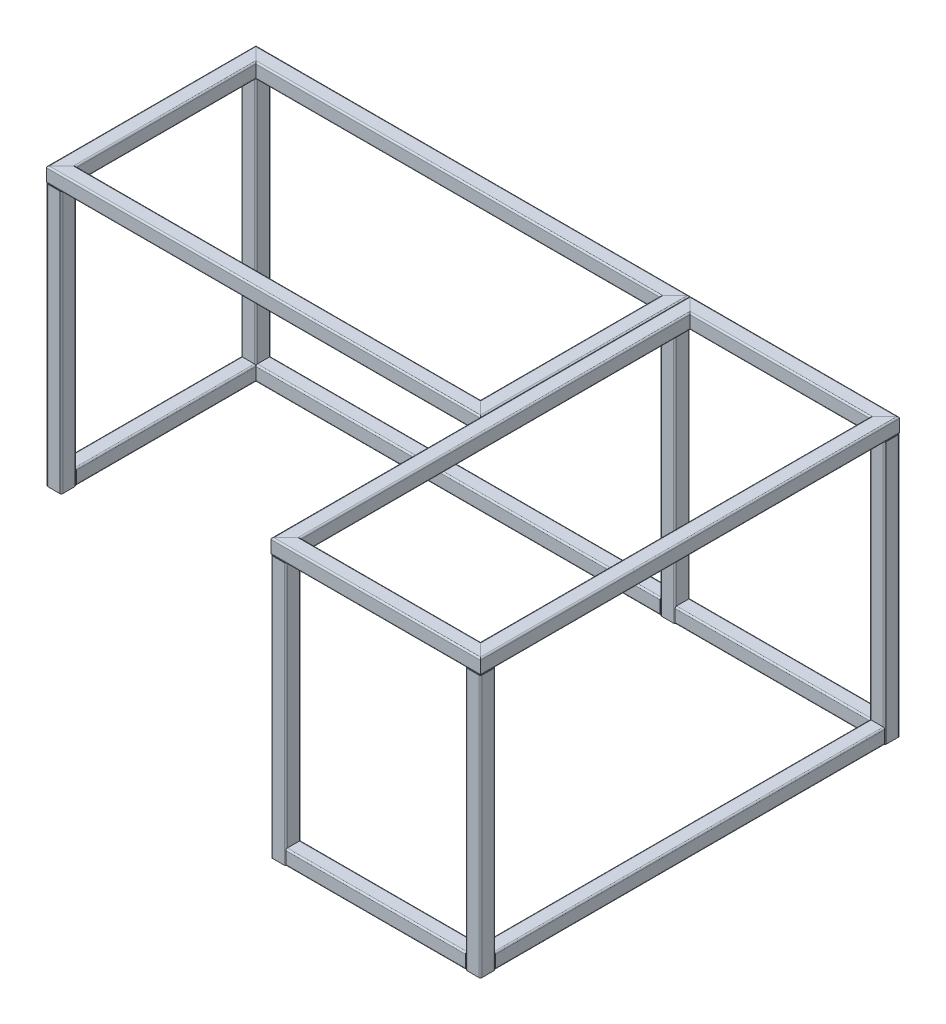
from build123d import *

# Parameters (mm, degrees)
SHS_C350_AS_40X40X2_0_SHS_C350_1_DEPTH      = 617.568542495
SHS_C350_AS_40X40X2_0_SHS_C350_1_DEPTH_BACK = 57.568542495
SHS_C350_AS_40X40X2_0_SHS_C350_1_2_DEPTH    = 1275.13708499
SHS_C350_AS_40X40X2_0_SHS_C350_1_3_DEPTH    = 675.13708499
SHS_C350_AS_40X40X2_0_SHS_C350_1_4_DEPTH    = 1275.13708499
SHS_C350_AS_40X40X2_0_SHS_C350_2_DEPTH      = 1177.568542495
SHS_C350_AS_40X40X2_0_SHS_C350_2_DEPTH_BACK = 57.568542495
SHS_C350_AS_40X40X2_0_SHS_C350_2_2_DEPTH    = 675.13708499
SHS_C350_AS_40X40X2_0_SHS_C350_2_3_DEPTH    = 1235.13708499
SHS_C350_AS_40X40X2_0_SHS_C350_2_4_DEPTH    = 675.13708499
SHS_START                                   = -740
SHS_C350_AS_40X40X2_0_SHS_C350_8_DEPTH      = 700
SHS_START_2                                 = -240
SHS_C350_AS_40X40X2_0_SHS_C350_8_2_DEPTH    = 480
SHS_START_3                                 = -540
SHS_C350_AS_40X40X2_0_SHS_C350_8_3_DEPTH    = 1080
SHS_START_4                                 = 580
SHS_C350_AS_40X40X2_0_SHS_C350_8_4_DEPTH    = 520
SHS_C350_AS_40X40X2_0_SHS_C350_8_5_DEPTH    = 1040
SHS_START_5                                 = 620
SHS_C350_AS_40X40X2_0_SHS_C350_8_6_DEPTH    = 480
SHS_C350_AS_40X40X2_0_SHS_C350_8_7_DEPTH    = 700
SHS_C350_AS_40X40X2_0_SHS_C350_8_8_DEPTH    = 700
SHS_C350_AS_40X40X2_0_SHS_C350_8_9_DEPTH    = 700
SHS_C350_AS_40X40X2_0_SHS_C350_8_10_DEPTH   = 700
SHS_C350_AS_40X40X2_0_SHS_C350_8_11_DEPTH   = 700


with BuildPart() as part:
    # Sketch11 → Shs c350 as 40X40X2.0 SHS C350(1) (new, two sides: drawn at the far end of the back side and taken through both)
    with BuildSketch(Plane(origin=(-560, -20, 280), x_dir=(-1, 0, 0), z_dir=(0, 0, -1)).offset(-SHS_C350_AS_40X40X2_0_SHS_C350_1_DEPTH_BACK)):
        with BuildLine():
            Line((-16, -20), (16, -20))
            ThreePointArc((16, -20), (18.828427125, -18.828427125), (20, -16))
            Line((20, -16), (20, 16))
            ThreePointArc((20, 16), (18.828427125, 18.828427125), (16, 20))
            Line((16, 20), (-16, 20))
            ThreePointArc((-16, 20), (-18.828427125, 18.828427125), (-20, 16))
            Line((-20, 16), (-20, -16))
            ThreePointArc((-20, -16), (-18.828427125, -18.828427125), (-16, -20))
        make_face()
        with BuildLine():
            Line((-16, 18), (16, 18))
            ThreePointArc((16, 18), (17.414213562, 17.414213562), (18, 16))
            Line((18, 16), (18, -16))
            ThreePointArc((18, -16), (17.414213562, -17.414213562), (16, -18))
            Line((16, -18), (-16, -18))
            ThreePointArc((-16, -18), (-17.414213562, -17.414213562), (-18, -16))
            Line((-18, -16), (-18, 16))
            ThreePointArc((-18, 16), (-17.414213562, 17.414213562), (-16, 18))
        make_face(mode=Mode.SUBTRACT)
    extrude(amount=SHS_C350_AS_40X40X2_0_SHS_C350_1_DEPTH + SHS_C350_AS_40X40X2_0_SHS_C350_1_DEPTH_BACK)

    # Shs c350 as 40X40X2.0 SHS C350(1) mitre 1
    split(bisect_by=Plane(origin=(-580, 0, 280), x_dir=(0, -1, 0), z_dir=(-0.707106781, 0, -0.707106781)), keep=Keep.TOP)

    # Shs c350 as 40X40X2.0 SHS C350(1) mitre 2
    split(bisect_by=Plane(origin=(-580, 0, -280), x_dir=(0, -1, 0), z_dir=(-0.707106781, 0, 0.707106781)), keep=Keep.TOP)


with BuildPart() as body_2:
    # Sketch11 on segment 2 (carried to segment 2) → Shs c350 as 40X40X2.0 SHS C350_1 2 (new body)
    with BuildSketch(Plane(origin=(-637.568542495, -20, -260), x_dir=(0, 0, -1), z_dir=(1, 0, 0))):
        with BuildLine():
            Line((-16, -20), (16, -20))
            ThreePointArc((16, -20), (18.828427125, -18.828427125), (20, -16))
            Line((20, -16), (20, 16))
            ThreePointArc((20, 16), (18.828427125, 18.828427125), (16, 20))
            Line((16, 20), (-16, 20))
            ThreePointArc((-16, 20), (-18.828427125, 18.828427125), (-20, 16))
            Line((-20, 16), (-20, -16))
            ThreePointArc((-20, -16), (-18.828427125, -18.828427125), (-16, -20))
        make_face()
        with BuildLine():
            Line((-16, 18), (16, 18))
            ThreePointArc((16, 18), (17.414213562, 17.414213562), (18, 16))
            Line((18, 16), (18, -16))
            ThreePointArc((18, -16), (17.414213562, -17.414213562), (16, -18))
            Line((16, -18), (-16, -18))
            ThreePointArc((-16, -18), (-17.414213562, -17.414213562), (-18, -16))
            Line((-18, -16), (-18, 16))
            ThreePointArc((-18, 16), (-17.414213562, 17.414213562), (-16, 18))
        make_face(mode=Mode.SUBTRACT)
    extrude(amount=SHS_C350_AS_40X40X2_0_SHS_C350_1_2_DEPTH)

    # Shs c350 as 40X40X2.0 SHS C350_1 2 mitre
    split(bisect_by=Plane(origin=(-580, 0, -280), x_dir=(0, 1, 0), z_dir=(0.707106781, 0, -0.707106781)), keep=Keep.TOP)

    # Shs c350 as 40X40X2.0 SHS C350_1 2 m 2
    split(bisect_by=Plane(origin=(580, 0, -280), x_dir=(0, -1, 0), z_dir=(-0.707106781, 0, -0.707106781)), keep=Keep.TOP)


with BuildPart() as body_3:
    # Sketch11 on segment 3 (carried to segment 3) → Shs c350 as 40X40X2.0 SHS C350_1 3 (new body)
    with BuildSketch(Plane(origin=(560, -20, -337.568542495), x_dir=(1, 0, 0), z_dir=(0, 0, 1))):
        with BuildLine():
            Line((-16, -20), (16, -20))
            ThreePointArc((16, -20), (18.828427125, -18.828427125), (20, -16))
            Line((20, -16), (20, 16))
            ThreePointArc((20, 16), (18.828427125, 18.828427125), (16, 20))
            Line((16, 20), (-16, 20))
            ThreePointArc((-16, 20), (-18.828427125, 18.828427125), (-20, 16))
            Line((-20, 16), (-20, -16))
            ThreePointArc((-20, -16), (-18.828427125, -18.828427125), (-16, -20))
        make_face()
        with BuildLine():
            Line((-16, 18), (16, 18))
            ThreePointArc((16, 18), (17.414213562, 17.414213562), (18, 16))
            Line((18, 16), (18, -16))
            ThreePointArc((18, -16), (17.414213562, -17.414213562), (16, -18))
            Line((16, -18), (-16, -18))
            ThreePointArc((-16, -18), (-17.414213562, -17.414213562), (-18, -16))
            Line((-18, -16), (-18, 16))
            ThreePointArc((-18, 16), (-17.414213562, 17.414213562), (-16, 18))
        make_face(mode=Mode.SUBTRACT)
    extrude(amount=SHS_C350_AS_40X40X2_0_SHS_C350_1_3_DEPTH)

    # Shs c350 as 40X40X2.0 SHS C350_1 3 mitre
    split(bisect_by=Plane(origin=(580, 0, 280), x_dir=(0, 1, 0), z_dir=(0.707106781, 0, -0.707106781)), keep=Keep.TOP)

    # Shs c350 as 40X40X2.0 SHS C350_1 3 m 2
    split(bisect_by=Plane(origin=(580, 0, -280), x_dir=(0, 1, 0), z_dir=(0.707106781, 0, 0.707106781)), keep=Keep.TOP)


with BuildPart() as body_4:
    # Sketch11 on segment 4 (carried to segment 4) → Shs c350 as 40X40X2.0 SHS C350_1 4 (new body)
    with BuildSketch(Plane(origin=(637.568542495, -20, 260), x_dir=(0, 0, 1), z_dir=(-1, 0, 0))):
        with BuildLine():
            Line((-16, -20), (16, -20))
            ThreePointArc((16, -20), (18.828427125, -18.828427125), (20, -16))
            Line((20, -16), (20, 16))
            ThreePointArc((20, 16), (18.828427125, 18.828427125), (16, 20))
            Line((16, 20), (-16, 20))
            ThreePointArc((-16, 20), (-18.828427125, 18.828427125), (-20, 16))
            Line((-20, 16), (-20, -16))
            ThreePointArc((-20, -16), (-18.828427125, -18.828427125), (-16, -20))
        make_face()
        with BuildLine():
            Line((-16, 18), (16, 18))
            ThreePointArc((16, 18), (17.414213562, 17.414213562), (18, 16))
            Line((18, 16), (18, -16))
            ThreePointArc((18, -16), (17.414213562, -17.414213562), (16, -18))
            Line((16, -18), (-16, -18))
            ThreePointArc((-16, -18), (-17.414213562, -17.414213562), (-18, -16))
            Line((-18, -16), (-18, 16))
            ThreePointArc((-18, 16), (-17.414213562, 17.414213562), (-16, 18))
        make_face(mode=Mode.SUBTRACT)
    extrude(amount=SHS_C350_AS_40X40X2_0_SHS_C350_1_4_DEPTH)

    # Shs c350 as 40X40X2.0 SHS C350_1 4 mitre
    split(bisect_by=Plane(origin=(-580, 0, 280), x_dir=(0, 1, 0), z_dir=(0.707106781, 0, 0.707106781)), keep=Keep.TOP)

    # Shs c350 as 40X40X2.0 SHS C350_1 4 m 2
    split(bisect_by=Plane(origin=(580, 0, 280), x_dir=(0, -1, 0), z_dir=(-0.707106781, 0, 0.707106781)), keep=Keep.TOP)


with BuildPart() as body_5:
    # Sketch12 → Shs c350 as 40X40X2.0 SHS C350(2) (new, two sides: drawn at the far end of the back side and taken through both)
    with BuildSketch(Plane(origin=(600, -20, -280), x_dir=(1, 0, 0), z_dir=(0, 0, 1)).offset(-SHS_C350_AS_40X40X2_0_SHS_C350_2_DEPTH_BACK)):
        with BuildLine():
            Line((-16, -20), (16, -20))
            ThreePointArc((16, -20), (18.828427125, -18.828427125), (20, -16))
            Line((20, -16), (20, 16))
            ThreePointArc((20, 16), (18.828427125, 18.828427125), (16, 20))
            Line((16, 20), (-16, 20))
            ThreePointArc((-16, 20), (-18.828427125, 18.828427125), (-20, 16))
            Line((-20, 16), (-20, -16))
            ThreePointArc((-20, -16), (-18.828427125, -18.828427125), (-16, -20))
        make_face()
        with BuildLine():
            Line((-16, 18), (16, 18))
            ThreePointArc((16, 18), (17.414213562, 17.414213562), (18, 16))
            Line((18, 16), (18, -16))
            ThreePointArc((18, -16), (17.414213562, -17.414213562), (16, -18))
            Line((16, -18), (-16, -18))
            ThreePointArc((-16, -18), (-17.414213562, -17.414213562), (-18, -16))
            Line((-18, -16), (-18, 16))
            ThreePointArc((-18, 16), (-17.414213562, 17.414213562), (-16, 18))
        make_face(mode=Mode.SUBTRACT)
    extrude(amount=SHS_C350_AS_40X40X2_0_SHS_C350_2_DEPTH + SHS_C350_AS_40X40X2_0_SHS_C350_2_DEPTH_BACK)

    # Shs c350 as 40X40X2.0 SHS C350(2) mitre 1
    split(bisect_by=Plane(origin=(580, 0, -280), x_dir=(0, -1, 0), z_dir=(-0.707106781, 0, 0.707106781)), keep=Keep.TOP)

    # Shs c350 as 40X40X2.0 SHS C350(2) mitre 2
    split(bisect_by=Plane(origin=(580, 0, 840), x_dir=(0, -1, 0), z_dir=(-0.707106781, 0, -0.707106781)), keep=Keep.TOP)


with BuildPart() as body_6:
    # Sketch12 on segment 2 (carried to segment 2) → Shs c350 as 40X40X2.0 SHS C350_2 2 (new body)
    with BuildSketch(Plane(origin=(522.431457505, -20, 820), x_dir=(0, 0, -1), z_dir=(1, 0, 0))):
        with BuildLine():
            Line((-16, -20), (16, -20))
            ThreePointArc((16, -20), (18.828427125, -18.828427125), (20, -16))
            Line((20, -16), (20, 16))
            ThreePointArc((20, 16), (18.828427125, 18.828427125), (16, 20))
            Line((16, 20), (-16, 20))
            ThreePointArc((-16, 20), (-18.828427125, 18.828427125), (-20, 16))
            Line((-20, 16), (-20, -16))
            ThreePointArc((-20, -16), (-18.828427125, -18.828427125), (-16, -20))
        make_face()
        with BuildLine():
            Line((-16, 18), (16, 18))
            ThreePointArc((16, 18), (17.414213562, 17.414213562), (18, 16))
            Line((18, 16), (18, -16))
            ThreePointArc((18, -16), (17.414213562, -17.414213562), (16, -18))
            Line((16, -18), (-16, -18))
            ThreePointArc((-16, -18), (-17.414213562, -17.414213562), (-18, -16))
            Line((-18, -16), (-18, 16))
            ThreePointArc((-18, 16), (-17.414213562, 17.414213562), (-16, 18))
        make_face(mode=Mode.SUBTRACT)
    extrude(amount=SHS_C350_AS_40X40X2_0_SHS_C350_2_2_DEPTH)

    # Shs c350 as 40X40X2.0 SHS C350_2 2 mitre
    split(bisect_by=Plane(origin=(580, 0, 840), x_dir=(0, 1, 0), z_dir=(0.707106781, 0, 0.707106781)), keep=Keep.TOP)

    # Shs c350 as 40X40X2.0 SHS C350_2 2 m 2
    split(bisect_by=Plane(origin=(1140, 0, 840), x_dir=(0, -1, 0), z_dir=(-0.707106781, 0, 0.707106781)), keep=Keep.TOP)


with BuildPart() as body_7:
    # Sketch12 on segment 3 (carried to segment 3) → Shs c350 as 40X40X2.0 SHS C350_2 3 (new body)
    with BuildSketch(Plane(origin=(1120, -20, 897.568542495), x_dir=(-1, 0, 0), z_dir=(0, 0, -1))):
        with BuildLine():
            Line((-16, -20), (16, -20))
            ThreePointArc((16, -20), (18.828427125, -18.828427125), (20, -16))
            Line((20, -16), (20, 16))
            ThreePointArc((20, 16), (18.828427125, 18.828427125), (16, 20))
            Line((16, 20), (-16, 20))
            ThreePointArc((-16, 20), (-18.828427125, 18.828427125), (-20, 16))
            Line((-20, 16), (-20, -16))
            ThreePointArc((-20, -16), (-18.828427125, -18.828427125), (-16, -20))
        make_face()
        with BuildLine():
            Line((-16, 18), (16, 18))
            ThreePointArc((16, 18), (17.414213562, 17.414213562), (18, 16))
            Line((18, 16), (18, -16))
            ThreePointArc((18, -16), (17.414213562, -17.414213562), (16, -18))
            Line((16, -18), (-16, -18))
            ThreePointArc((-16, -18), (-17.414213562, -17.414213562), (-18, -16))
            Line((-18, -16), (-18, 16))
            ThreePointArc((-18, 16), (-17.414213562, 17.414213562), (-16, 18))
        make_face(mode=Mode.SUBTRACT)
    extrude(amount=SHS_C350_AS_40X40X2_0_SHS_C350_2_3_DEPTH)

    # Shs c350 as 40X40X2.0 SHS C350_2 3 mitre
    split(bisect_by=Plane(origin=(1140, 0, -280), x_dir=(0, 1, 0), z_dir=(0.707106781, 0, 0.707106781)), keep=Keep.TOP)

    # Shs c350 as 40X40X2.0 SHS C350_2 3 m 2
    split(bisect_by=Plane(origin=(1140, 0, 840), x_dir=(0, 1, 0), z_dir=(0.707106781, 0, -0.707106781)), keep=Keep.TOP)


with BuildPart() as body_8:
    # Sketch12 on segment 4 (carried to segment 4) → Shs c350 as 40X40X2.0 SHS C350_2 4 (new body)
    with BuildSketch(Plane(origin=(1197.568542495, -20, -260), x_dir=(0, 0, 1), z_dir=(-1, 0, 0))):
        with BuildLine():
            Line((-16, -20), (16, -20))
            ThreePointArc((16, -20), (18.828427125, -18.828427125), (20, -16))
            Line((20, -16), (20, 16))
            ThreePointArc((20, 16), (18.828427125, 18.828427125), (16, 20))
            Line((16, 20), (-16, 20))
            ThreePointArc((-16, 20), (-18.828427125, 18.828427125), (-20, 16))
            Line((-20, 16), (-20, -16))
            ThreePointArc((-20, -16), (-18.828427125, -18.828427125), (-16, -20))
        make_face()
        with BuildLine():
            Line((-16, 18), (16, 18))
            ThreePointArc((16, 18), (17.414213562, 17.414213562), (18, 16))
            Line((18, 16), (18, -16))
            ThreePointArc((18, -16), (17.414213562, -17.414213562), (16, -18))
            Line((16, -18), (-16, -18))
            ThreePointArc((-16, -18), (-17.414213562, -17.414213562), (-18, -16))
            Line((-18, -16), (-18, 16))
            ThreePointArc((-18, 16), (-17.414213562, 17.414213562), (-16, 18))
        make_face(mode=Mode.SUBTRACT)
    extrude(amount=SHS_C350_AS_40X40X2_0_SHS_C350_2_4_DEPTH)

    # Shs c350 as 40X40X2.0 SHS C350_2 4 mitre
    split(bisect_by=Plane(origin=(580, 0, -280), x_dir=(0, 1, 0), z_dir=(0.707106781, 0, -0.707106781)), keep=Keep.TOP)

    # Shs c350 as 40X40X2.0 SHS C350_2 4 m 2
    split(bisect_by=Plane(origin=(1140, 0, -280), x_dir=(0, -1, 0), z_dir=(-0.707106781, 0, -0.707106781)), keep=Keep.TOP)


with BuildPart() as body_9:
    # Shs c350 as 40X40X2.0 SHS C350(8): read off the stored shape, not the designer's step
    # Shs c350 as 40X40X2.0 SHS C350(8) outline → Shs c350 as 40X40X2.0 SHS C350(8) (new body)
    with BuildSketch(Plane(origin=(0, 0, 0), x_dir=(1, 0, 0), z_dir=(0, 1, 0)).offset(SHS_START)):
        with BuildLine():
            Line((-576, -280), (-544, -280))
            ThreePointArc((-544, -280), (-541.171572875, -278.828427125), (-540, -276))
            Line((-540, -276), (-540, -244))
            ThreePointArc((-540, -244), (-541.171572875, -241.171572875), (-544, -240))
            Line((-544, -240), (-576, -240))
            ThreePointArc((-576, -240), (-578.828427125, -241.171572875), (-580, -244))
            Line((-580, -244), (-580, -276))
            ThreePointArc((-580, -276), (-578.828427125, -278.828427125), (-576, -280))
        make_face()
        with BuildLine():
            ThreePointArc((-576, -278), (-577.414213562, -277.414213562), (-578, -276))
            Line((-578, -276), (-578, -244))
            ThreePointArc((-578, -244), (-577.414213562, -242.585786438), (-576, -242))
            Line((-576, -242), (-544, -242))
            ThreePointArc((-544, -242), (-542.585786438, -242.585786438), (-542, -244))
            Line((-542, -244), (-542, -276))
            ThreePointArc((-542, -276), (-542.585786438, -277.414213562), (-544, -278))
            Line((-544, -278), (-576, -278))
        make_face(mode=Mode.SUBTRACT)
    extrude(amount=SHS_C350_AS_40X40X2_0_SHS_C350_8_DEPTH)


with BuildPart() as body_10:
    # Shs c350 as 40X40X2.0 SHS C350_8 2 outli → Shs c350 as 40X40X2.0 SHS C350_8 2 (new body)
    with BuildSketch(Plane.XY.offset(SHS_START_2)):
        with BuildLine():
            Line((-540, -736), (-540, -704))
            ThreePointArc((-540, -704), (-541.171572875, -701.171572875), (-544, -700))
            Line((-544, -700), (-576, -700))
            ThreePointArc((-576, -700), (-578.828427125, -701.171572875), (-580, -704))
            Line((-580, -704), (-580, -736))
            ThreePointArc((-580, -736), (-578.828427125, -738.828427125), (-576, -740))
            Line((-576, -740), (-544, -740))
            ThreePointArc((-544, -740), (-541.171572875, -738.828427125), (-540, -736))
        make_face()
        with BuildLine():
            ThreePointArc((-544, -702), (-542.585786438, -702.585786438), (-542, -704))
            Line((-542, -704), (-542, -736))
            ThreePointArc((-542, -736), (-542.585786438, -737.414213562), (-544, -738))
            Line((-544, -738), (-576, -738))
            ThreePointArc((-576, -738), (-577.414213562, -737.414213562), (-578, -736))
            Line((-578, -736), (-578, -704))
            ThreePointArc((-578, -704), (-577.414213562, -702.585786438), (-576, -702))
            Line((-576, -702), (-544, -702))
        make_face(mode=Mode.SUBTRACT)
    extrude(amount=SHS_C350_AS_40X40X2_0_SHS_C350_8_2_DEPTH)


with BuildPart() as body_11:
    # Shs c350 as 40X40X2.0 SHS C350_8 3 outli → Shs c350 as 40X40X2.0 SHS C350_8 3 (new body)
    with BuildSketch(Plane.YZ.offset(SHS_START_3)):
        with BuildLine():
            ThreePointArc((-700, -244), (-701.171572875, -241.171572875), (-704, -240))
            Line((-704, -240), (-736, -240))
            ThreePointArc((-736, -240), (-738.828427125, -241.171572875), (-740, -244))
            Line((-740, -244), (-740, -276))
            ThreePointArc((-740, -276), (-738.828427125, -278.828427125), (-736, -280))
            Line((-736, -280), (-704, -280))
            ThreePointArc((-704, -280), (-701.171572875, -278.828427125), (-700, -276))
            Line((-700, -276), (-700, -244))
        make_face()
        with BuildLine():
            Line((-736, -242), (-704, -242))
            ThreePointArc((-704, -242), (-702.585786438, -242.585786438), (-702, -244))
            Line((-702, -244), (-702, -276))
            ThreePointArc((-702, -276), (-702.585786438, -277.414213562), (-704, -278))
            Line((-704, -278), (-736, -278))
            ThreePointArc((-736, -278), (-737.414213562, -277.414213562), (-738, -276))
            Line((-738, -276), (-738, -244))
            ThreePointArc((-738, -244), (-737.414213562, -242.585786438), (-736, -242))
        make_face(mode=Mode.SUBTRACT)
    extrude(amount=SHS_C350_AS_40X40X2_0_SHS_C350_8_3_DEPTH)


with BuildPart() as body_12:
    # Shs c350 as 40X40X2.0 SHS C350_8 4 outli → Shs c350 as 40X40X2.0 SHS C350_8 4 (new body)
    with BuildSketch(Plane.YZ.offset(SHS_START_4)):
        with BuildLine():
            Line((-700, -276), (-700, -244))
            ThreePointArc((-700, -244), (-701.171572875, -241.171572875), (-704, -240))
            Line((-704, -240), (-736, -240))
            ThreePointArc((-736, -240), (-738.828427125, -241.171572875), (-740, -244))
            Line((-740, -244), (-740, -276))
            ThreePointArc((-740, -276), (-738.828427125, -278.828427125), (-736, -280))
            Line((-736, -280), (-704, -280))
            ThreePointArc((-704, -280), (-701.171572875, -278.828427125), (-700, -276))
        make_face()
        with BuildLine():
            ThreePointArc((-738, -244), (-737.414213562, -242.585786438), (-736, -242))
            Line((-736, -242), (-704, -242))
            ThreePointArc((-704, -242), (-702.585786438, -242.585786438), (-702, -244))
            Line((-702, -244), (-702, -276))
            ThreePointArc((-702, -276), (-702.585786438, -277.414213562), (-704, -278))
            Line((-704, -278), (-736, -278))
            ThreePointArc((-736, -278), (-737.414213562, -277.414213562), (-738, -276))
            Line((-738, -276), (-738, -244))
        make_face(mode=Mode.SUBTRACT)
    extrude(amount=SHS_C350_AS_40X40X2_0_SHS_C350_8_4_DEPTH)


with BuildPart() as body_13:
    # Shs c350 as 40X40X2.0 SHS C350_8 5 outli → Shs c350 as 40X40X2.0 SHS C350_8 5 (new body)
    with BuildSketch(Plane.XY.offset(SHS_START_2)):
        with BuildLine():
            ThreePointArc((1104, -700), (1101.171572875, -701.171572875), (1100, -704))
            Line((1100, -704), (1100, -736))
            ThreePointArc((1100, -736), (1101.171572875, -738.828427125), (1104, -740))
            Line((1104, -740), (1136, -740))
            ThreePointArc((1136, -740), (1138.828427125, -738.828427125), (1140, -736))
            Line((1140, -736), (1140, -704))
            ThreePointArc((1140, -704), (1138.828427125, -701.171572875), (1136, -700))
            Line((1136, -700), (1104, -700))
        make_face()
        with BuildLine():
            Line((1102, -736), (1102, -704))
            ThreePointArc((1102, -704), (1102.585786438, -702.585786438), (1104, -702))
            Line((1104, -702), (1136, -702))
            ThreePointArc((1136, -702), (1137.414213562, -702.585786438), (1138, -704))
            Line((1138, -704), (1138, -736))
            ThreePointArc((1138, -736), (1137.414213562, -737.414213562), (1136, -738))
            Line((1136, -738), (1104, -738))
            ThreePointArc((1104, -738), (1102.585786438, -737.414213562), (1102, -736))
        make_face(mode=Mode.SUBTRACT)
    extrude(amount=SHS_C350_AS_40X40X2_0_SHS_C350_8_5_DEPTH)


with BuildPart() as body_14:
    # Shs c350 as 40X40X2.0 SHS C350_8 6 outli → Shs c350 as 40X40X2.0 SHS C350_8 6 (new body)
    with BuildSketch(Plane.YZ.offset(SHS_START_5)):
        with BuildLine():
            Line((-700, 804), (-700, 836))
            ThreePointArc((-700, 836), (-701.171572875, 838.828427125), (-704, 840))
            Line((-704, 840), (-736, 840))
            ThreePointArc((-736, 840), (-738.828427125, 838.828427125), (-740, 836))
            Line((-740, 836), (-740, 804))
            ThreePointArc((-740, 804), (-738.828427125, 801.171572875), (-736, 800))
            Line((-736, 800), (-704, 800))
            ThreePointArc((-704, 800), (-701.171572875, 801.171572875), (-700, 804))
        make_face()
        with BuildLine():
            ThreePointArc((-702, 804), (-702.585786438, 802.585786438), (-704, 802))
            Line((-704, 802), (-736, 802))
            ThreePointArc((-736, 802), (-737.414213562, 802.585786438), (-738, 804))
            Line((-738, 804), (-738, 836))
            ThreePointArc((-738, 836), (-737.414213562, 837.414213562), (-736, 838))
            Line((-736, 838), (-704, 838))
            ThreePointArc((-704, 838), (-702.585786438, 837.414213562), (-702, 836))
            Line((-702, 836), (-702, 804))
        make_face(mode=Mode.SUBTRACT)
    extrude(amount=SHS_C350_AS_40X40X2_0_SHS_C350_8_6_DEPTH)


with BuildPart() as body_15:
    # Shs c350 as 40X40X2.0 SHS C350_8 7 outli → Shs c350 as 40X40X2.0 SHS C350_8 7 (new body)
    with BuildSketch(Plane(origin=(0, 0, 0), x_dir=(1, 0, 0), z_dir=(0, 1, 0)).offset(SHS_START)):
        with BuildLine():
            Line((584, -840), (616, -840))
            ThreePointArc((616, -840), (618.828427125, -838.828427125), (620, -836))
            Line((620, -836), (620, -804))
            ThreePointArc((620, -804), (618.828427125, -801.171572875), (616, -800))
            Line((616, -800), (584, -800))
            ThreePointArc((584, -800), (581.171572875, -801.171572875), (580, -804))
            Line((580, -804), (580, -836))
            ThreePointArc((580, -836), (581.171572875, -838.828427125), (584, -840))
        make_face()
        with BuildLine():
            ThreePointArc((584, -838), (582.585786438, -837.414213562), (582, -836))
            Line((582, -836), (582, -804))
            ThreePointArc((582, -804), (582.585786438, -802.585786438), (584, -802))
            Line((584, -802), (616, -802))
            ThreePointArc((616, -802), (617.414213562, -802.585786438), (618, -804))
            Line((618, -804), (618, -836))
            ThreePointArc((618, -836), (617.414213562, -837.414213562), (616, -838))
            Line((616, -838), (584, -838))
        make_face(mode=Mode.SUBTRACT)
    extrude(amount=SHS_C350_AS_40X40X2_0_SHS_C350_8_7_DEPTH)


with BuildPart() as body_16:
    # Shs c350 as 40X40X2.0 SHS C350_8 8 outli → Shs c350 as 40X40X2.0 SHS C350_8 8 (new body)
    with BuildSketch(Plane(origin=(0, 0, 0), x_dir=(1, 0, 0), z_dir=(0, 1, 0)).offset(SHS_START)):
        with BuildLine():
            Line((1100, -804), (1100, -836))
            ThreePointArc((1100, -836), (1101.171572875, -838.828427125), (1104, -840))
            Line((1104, -840), (1136, -840))
            ThreePointArc((1136, -840), (1138.828427125, -838.828427125), (1140, -836))
            Line((1140, -836), (1140, -804))
            ThreePointArc((1140, -804), (1138.828427125, -801.171572875), (1136, -800))
            Line((1136, -800), (1104, -800))
            ThreePointArc((1104, -800), (1101.171572875, -801.171572875), (1100, -804))
        make_face()
        with BuildLine():
            ThreePointArc((1104, -838), (1102.585786438, -837.414213562), (1102, -836))
            Line((1102, -836), (1102, -804))
            ThreePointArc((1102, -804), (1102.585786438, -802.585786438), (1104, -802))
            Line((1104, -802), (1136, -802))
            ThreePointArc((1136, -802), (1137.414213562, -802.585786438), (1138, -804))
            Line((1138, -804), (1138, -836))
            ThreePointArc((1138, -836), (1137.414213562, -837.414213562), (1136, -838))
            Line((1136, -838), (1104, -838))
        make_face(mode=Mode.SUBTRACT)
    extrude(amount=SHS_C350_AS_40X40X2_0_SHS_C350_8_8_DEPTH)


with BuildPart() as body_17:
    # Shs c350 as 40X40X2.0 SHS C350_8 9 outli → Shs c350 as 40X40X2.0 SHS C350_8 9 (new body)
    with BuildSketch(Plane(origin=(0, 0, 0), x_dir=(1, 0, 0), z_dir=(0, 1, 0)).offset(SHS_START)):
        with BuildLine():
            Line((1100, 276), (1100, 244))
            ThreePointArc((1100, 244), (1101.171572875, 241.171572875), (1104, 240))
            Line((1104, 240), (1136, 240))
            ThreePointArc((1136, 240), (1138.828427125, 241.171572875), (1140, 244))
            Line((1140, 244), (1140, 276))
            ThreePointArc((1140, 276), (1138.828427125, 278.828427125), (1136, 280))
            Line((1136, 280), (1104, 280))
            ThreePointArc((1104, 280), (1101.171572875, 278.828427125), (1100, 276))
        make_face()
        with BuildLine():
            ThreePointArc((1104, 242), (1102.585786438, 242.585786438), (1102, 244))
            Line((1102, 244), (1102, 276))
            ThreePointArc((1102, 276), (1102.585786438, 277.414213562), (1104, 278))
            Line((1104, 278), (1136, 278))
            ThreePointArc((1136, 278), (1137.414213562, 277.414213562), (1138, 276))
            Line((1138, 276), (1138, 244))
            ThreePointArc((1138, 244), (1137.414213562, 242.585786438), (1136, 242))
            Line((1136, 242), (1104, 242))
        make_face(mode=Mode.SUBTRACT)
    extrude(amount=SHS_C350_AS_40X40X2_0_SHS_C350_8_9_DEPTH)


with BuildPart() as body_18:
    # Shs c350 as 40X40X2.0 SHS C350_8 10 outl → Shs c350 as 40X40X2.0 SHS C350_8 10 (new body)
    with BuildSketch(Plane(origin=(0, 0, 0), x_dir=(1, 0, 0), z_dir=(0, 1, 0)).offset(SHS_START)):
        with BuildLine():
            Line((540, 276), (540, 244))
            ThreePointArc((540, 244), (541.171572875, 241.171572875), (544, 240))
            Line((544, 240), (576, 240))
            ThreePointArc((576, 240), (578.828427125, 241.171572875), (580, 244))
            Line((580, 244), (580, 276))
            ThreePointArc((580, 276), (578.828427125, 278.828427125), (576, 280))
            Line((576, 280), (544, 280))
            ThreePointArc((544, 280), (541.171572875, 278.828427125), (540, 276))
        make_face()
        with BuildLine():
            ThreePointArc((544, 242), (542.585786438, 242.585786438), (542, 244))
            Line((542, 244), (542, 276))
            ThreePointArc((542, 276), (542.585786438, 277.414213562), (544, 278))
            Line((544, 278), (576, 278))
            ThreePointArc((576, 278), (577.414213562, 277.414213562), (578, 276))
            Line((578, 276), (578, 244))
            ThreePointArc((578, 244), (577.414213562, 242.585786438), (576, 242))
            Line((576, 242), (544, 242))
        make_face(mode=Mode.SUBTRACT)
    extrude(amount=SHS_C350_AS_40X40X2_0_SHS_C350_8_10_DEPTH)


with BuildPart() as body_19:
    # Shs c350 as 40X40X2.0 SHS C350_8 11 outl → Shs c350 as 40X40X2.0 SHS C350_8 11 (new body)
    with BuildSketch(Plane(origin=(0, 0, 0), x_dir=(1, 0, 0), z_dir=(0, 1, 0)).offset(SHS_START)):
        with BuildLine():
            Line((-580, 276), (-580, 244))
            ThreePointArc((-580, 244), (-578.828427125, 241.171572875), (-576, 240))
            Line((-576, 240), (-544, 240))
            ThreePointArc((-544, 240), (-541.171572875, 241.171572875), (-540, 244))
            Line((-540, 244), (-540, 276))
            ThreePointArc((-540, 276), (-541.171572875, 278.828427125), (-544, 280))
            Line((-544, 280), (-576, 280))
            ThreePointArc((-576, 280), (-578.828427125, 278.828427125), (-580, 276))
        make_face()
        with BuildLine():
            ThreePointArc((-576, 242), (-577.414213562, 242.585786438), (-578, 244))
            Line((-578, 244), (-578, 276))
            ThreePointArc((-578, 276), (-577.414213562, 277.414213562), (-576, 278))
            Line((-576, 278), (-544, 278))
            ThreePointArc((-544, 278), (-542.585786438, 277.414213562), (-542, 276))
            Line((-542, 276), (-542, 244))
            ThreePointArc((-542, 244), (-542.585786438, 242.585786438), (-544, 242))
            Line((-544, 242), (-576, 242))
        make_face(mode=Mode.SUBTRACT)
    extrude(amount=SHS_C350_AS_40X40X2_0_SHS_C350_8_11_DEPTH)


solid = Compound([part.part, body_2.part, body_3.part, body_4.part, body_5.part, body_6.part, body_7.part, body_8.part, body_9.part, body_10.part, body_11.part, body_12.part, body_13.part, body_14.part, body_15.part, body_16.part, body_17.part, body_18.part, body_19.part])
